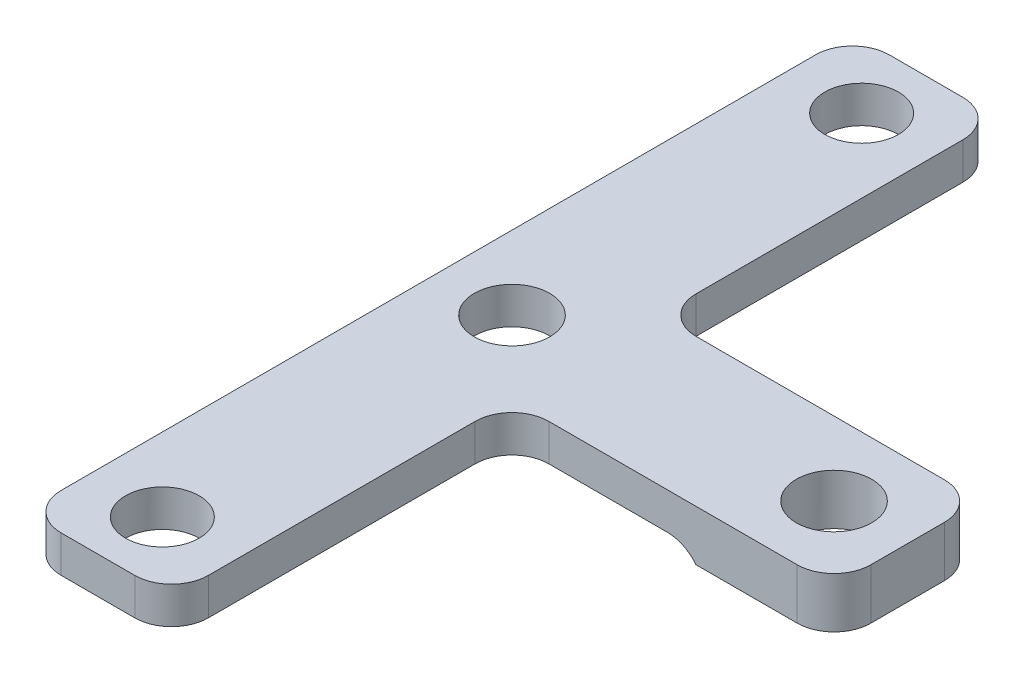
from build123d import *

# Parameters (mm, degrees)
SKETCH1_R           = 4.1
BOSS_EXTRUDE1_DEPTH = 4
SKETCH2_R           = 4
CUT_EXTRUDE1_DEPTH  = 10
FILLET1_R           = 4
SKETCH3_R           = 4.1
CUT_EXTRUDE2_DEPTH  = 10
SKETCH4_R           = 4.1
BOSS_EXTRUDE3_DEPTH = 1.5
FILLET3_R           = 4


with BuildPart() as part:
    # Sketch1 → Boss-Extrude1 (new body)
    with BuildSketch(Plane(origin=(0, 0, 0), x_dir=(1, 0, 0), z_dir=(0, 1, 0))):
        Polygon((-8, 45), (-8, -45), (8, -45), (8, -8), (43, -8), (43, 8), (8, 8), (8, 45), align=None)
        with Locations(Location((0, 0, 0), (0, 0, 270))):
            Circle(SKETCH1_R, mode=Mode.SUBTRACT)
    extrude(amount=BOSS_EXTRUDE1_DEPTH)

    # Sketch2 → Cut-Extrude1 (cut)
    with BuildSketch(Plane(origin=(0, 4, 0), x_dir=(1, 0, 0), z_dir=(0, 1, 0))):
        with Locations(Location((0, -38, 0), (0, 0, 270))):
            Circle(SKETCH2_R)
    cut_extrude1 = extrude(amount=-CUT_EXTRUDE1_DEPTH, mode=Mode.SUBTRACT)

    # Mirror1: Cut-Extrude1 across plane
    add(cut_extrude1.mirror(Plane.XY), mode=Mode.SUBTRACT)

    # Fillet1
    fillet1_edges = [part.edges().sort_by_distance(p)[0] for p in [
        (43, 2, -8),
        (43, 2, 8),
        (8, 2, 8),
        (8, 2, 45),
        (-8, 2, 45),
        (-8, 2, -45),
        (8, 2, -45),
        (8, 2, -8),
    ]]
    fillet(fillet1_edges, radius=FILLET1_R)

    # Sketch3 → Cut-Extrude2 (cut)
    with BuildSketch(Plane(origin=(0, 4, 0), x_dir=(1, 0, 0), z_dir=(0, 1, 0))):
        with Locations(Location((35, 0, 0), (0, 0, 270))):
            Circle(SKETCH3_R)
    extrude(amount=-CUT_EXTRUDE2_DEPTH, mode=Mode.SUBTRACT)

    # Sketch4 → Boss-Extrude3 (add)
    with BuildSketch(Plane(origin=(0, 0, 0), x_dir=(1, 0, 0), z_dir=(0, 1, 0))):
        with BuildLine():
            Line((39, 8), (28, 8))
            Line((28, 8), (28, -8))
            Line((28, -8), (39, -8))
            ThreePointArc((39, -8), (41.828427125, -6.828427125), (43, -4))
            Line((43, -4), (43, 4))
            ThreePointArc((43, 4), (41.828427125, 6.828427125), (39, 8))
        make_face()
        with Locations(Location((35, 0, 0), (0, 0, 270))):
            Circle(SKETCH4_R, mode=Mode.SUBTRACT)
    extrude(amount=-BOSS_EXTRUDE3_DEPTH)

    # Fillet3
    # the kernel refuses this fillet: 4 mm, written as the material it adds along each edge
    with BuildSketch(Plane(origin=(28, 0, -8), x_dir=(0, -1, 0), z_dir=(0, 0, 1))) as fillet3_piece_1:
        with BuildLine():
            CenterArc((4, -3.122498999), FILLET3_R, 128.682187453, 51.317812547)
            Line((0, -3.122498999), (-0.08, -3.122498999))
            Line((-0.08, -3.122498999), (-0.08, 0))
            Line((-0.08, 0), (0, 0.08))
            ThreePointArc((0, 0.08), (0.75, 0.08), (1.45, 0.06244998))
            Line((1.45, 0.06244998), (1.5, 0))
        make_face()
    extrude(amount=16)


solid = part.part
